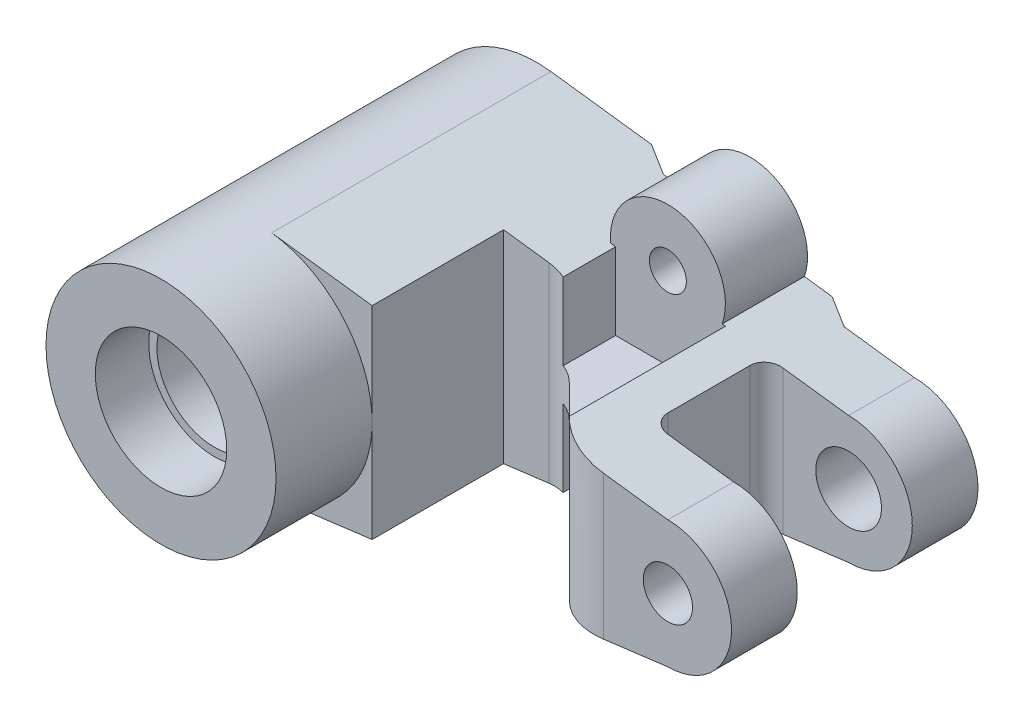
from build123d import *

# Parameters (mm, degrees)
SKETCH1_R                = 7
SKETCH1_R_2              = 3.5
CYLINDER_DEPTH           = 22.85
SKETCH2_R                = 4
BORE_1_DEPTH             = 3.25
BORE_START               = -3.25
SKETCH3_R                = 4
BORE_2_DEPTH             = 3.25
ARM_DEPTH                = 17
SKETCH5_R                = 3.5
OUTER_HOLE_SURFACE_DEPTH = 6
SKETCH6_R                = 1.125
OUTER_HOLE_DEPTH         = 6
SIDE_FEATURES_DEPTH      = 22
RIB_START                = -11
SKETCH10_W               = 6.681980515
SKETCH10_H               = 4.679772507
RIB_DEPTH                = 9.5
SKETCH13_R               = 1.5
BOTTOM_HOLE_DEPTH        = 4


# Read off the part's stored shape, not the designer's step: Top Counter-sunk
with BuildPart() as part:
    # Sketch1 → Cylinder (new body)
    with BuildSketch(Plane.XY):
        with Locations(Location((0, 0, 0), (0, 0, 180))):
            Circle(SKETCH1_R)
        with Locations(Location((0, 0, 0), (0, 0, 180))):
            Circle(SKETCH1_R_2, mode=Mode.SUBTRACT)
    extrude(amount=CYLINDER_DEPTH)

    # Sketch2 → Bore 1 (cut)
    with BuildSketch(Plane.XY.offset(22.85)):
        Circle(SKETCH2_R)
    extrude(amount=-BORE_1_DEPTH, mode=Mode.SUBTRACT)

    # Sketch3 → Bore 2 (cut)
    with BuildSketch(Plane(origin=(0, 0, 0), x_dir=(-1, 0, 0), z_dir=(0, 0, -1)).offset(BORE_START)):
        with Locations(Location((0, 0, 0), (0, 0, 180))):
            Circle(SKETCH3_R)
    extrude(amount=BORE_2_DEPTH, mode=Mode.SUBTRACT)

    # Sketch4 → Arm (add)
    with BuildSketch(Plane.XY):
        with BuildLine():
            Line((0.8836803, 6.943998065), (25, 3.875))
            ThreePointArc((25, 3.875), (28.875, 0), (25, -3.875))
            Line((25, -3.875), (0.8836803, -6.943998065))
            ThreePointArc((0.8836803, -6.943998065), (7, 0), (0.8836803, 6.943998065))
        make_face()
    extrude(amount=ARM_DEPTH)

    # Sketch5 → Outer Hole surface (add)
    with BuildSketch(Plane(origin=(0, 0, 0), x_dir=(-1, 0, 0), z_dir=(0, 0, -1))):
        with Locations((-14, 6)):
            Circle(SKETCH5_R)
    extrude(amount=-OUTER_HOLE_SURFACE_DEPTH)

    # Sketch6 → Outer hole (cut)
    with BuildSketch(Plane(origin=(0, 0, 0), x_dir=(-1, 0, 0), z_dir=(0, 0, -1))):
        with Locations((-14, 6)):
            Circle(SKETCH6_R)
    extrude(amount=-OUTER_HOLE_DEPTH, mode=Mode.SUBTRACT)

    # Sketch8 → side Features (cut)
    with BuildSketch(Plane(origin=(0, 10, 0), x_dir=(1, 0, 0), z_dir=(0, 1, 0))):
        with BuildLine():
            Line((21, -6), (40, -6))
            Line((40, -6), (40, -13))
            Line((40, -13), (21, -13))
            ThreePointArc((21, -13), (20.292893219, -12.707106781), (20, -12))
            Line((20, -12), (20, -7))
            ThreePointArc((20, -7), (20.292893219, -6.292893219), (21, -6))
        make_face()
        with BuildLine():
            Line((7, -19), (7, -9))
            Line((7, -9), (9.757359313, -9))
            ThreePointArc((9.757359313, -9), (10.90540961, -9.228361402), (11.878679656, -9.878679656))
            Line((11.878679656, -9.878679656), (17.535533906, -15.535533906))
            ThreePointArc((17.535533906, -15.535533906), (19.15765065, -16.619397663), (21.071067812, -17))
            Line((21.071067812, -17), (27, -17))
            Line((27, -17), (27, -19))
            Line((27, -19), (7, -19))
        make_face()
        Polygon((7, 0), (8.732050808, -1), (19, -1), (20.732050808, -2), (40, -2), (40, 0), align=None)
    extrude(amount=-SIDE_FEATURES_DEPTH, mode=Mode.SUBTRACT)

    # Sketch10 → Rib (cut)
    with BuildSketch(Plane.XY.offset(17).offset(RIB_START)):
        with Locations((14.159009743, 3.339886254)):
            Rectangle(SKETCH10_W, SKETCH10_H)
        with Locations((14.159009743, -3.339886254)):
            Rectangle(SKETCH10_W, SKETCH10_H)
    extrude(amount=RIB_DEPTH, mode=Mode.SUBTRACT)

    # Top Counter-sunk outline → Top Counter-sunk (revolve, cut)
    with BuildSketch(Plane(origin=(25, 0, 0), x_dir=(1, 0, 0), z_dir=(0, -1, 0))):
        Polygon((2, 3.150368407), (2, 6), (0, 6), (0, 2), (3, 2), align=None)
    revolve(axis=Axis((25, 0, 0), (0, 0, 1)), mode=Mode.SUBTRACT)

    # Sketch13 → Bottom hole (cut)
    with BuildSketch(Plane.XY.offset(17)):
        with Locations((25, 0)):
            Circle(SKETCH13_R)
    extrude(amount=-BOTTOM_HOLE_DEPTH, mode=Mode.SUBTRACT)


solid = part.part
